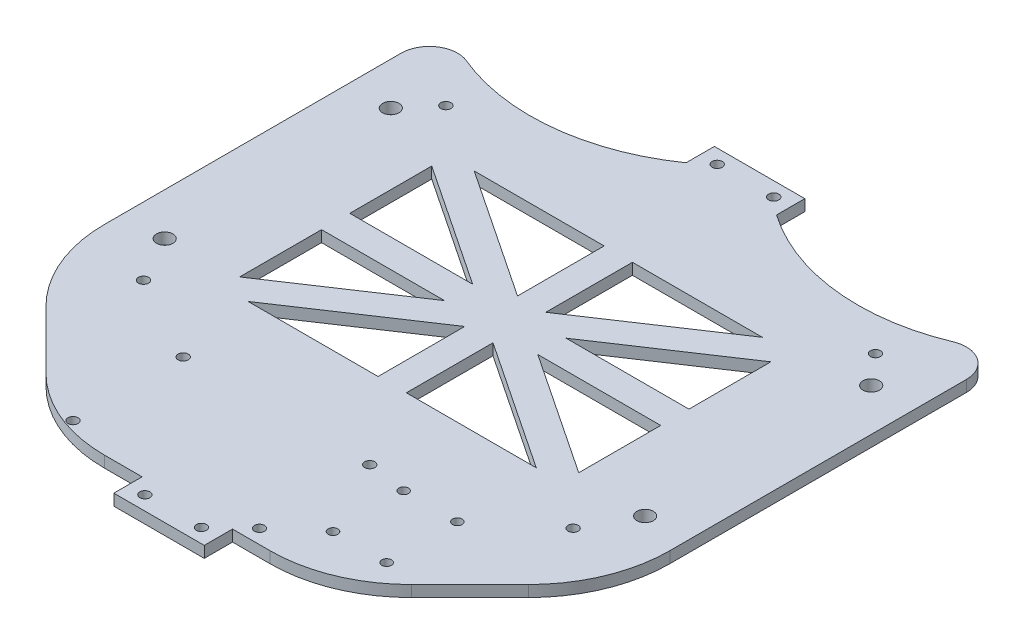
from build123d import *

# Parameters (mm, degrees)
BOSS_EXTRUDE1_DEPTH      = 4
M5_CLEARANCE_HOLE1_D     = 5.8
FILLET1_R                = 10
M3_CLEARANCE_HOLE1_D     = 3.6
M3_CLEARANCE_HOLE1_DEPTH = 10
M3_CLEARANCE_HOLE1_TIP   = 1.081549114
CHAMFER1_SIZE            = 50
FILLET3_R                = 50
M3_CLEARANCE_HOLE2_D     = 3.6
M3_CLEARANCE_HOLE3_D     = 3.4


with BuildPart() as part:
    # Sketch1 → Boss-Extrude1 (new body)
    with BuildSketch(Plane(origin=(0, 0, 0), x_dir=(1, 0, 0), z_dir=(0, 1, 0))):
        with BuildLine():
            Line((-100, -29.5), (-100, -222))
            Line((-100, -222), (-16, -222))
            Line((-16, -222), (-16, -232))
            Line((-16, -232), (16, -232))
            Line((16, -232), (16, -222))
            Line((16, -222), (100, -222))
            Line((100, -222), (100, -29.5))
            ThreePointArc((100, -29.5), (58, -42.739333694), (16, -29.5))
            Line((16, -29.5), (16, -19.5))
            Line((16, -19.5), (-16, -19.5))
            Line((-16, -19.5), (-16, -29.5))
            ThreePointArc((-16, -29.5), (-58, -42.739333694), (-100, -29.5))
        make_face()
        Polygon((-60, -143.490747874), (-60, -114.5), (-16.513878189, -114.5), align=None, mode=Mode.SUBTRACT)
        Polygon((-5, -149.5), (-50.986121811, -149.5), (-5, -118.842585459), align=None, mode=Mode.SUBTRACT)
        Polygon((50.986121811, -149.5), (5, -149.5), (5, -118.842585459), align=None, mode=Mode.SUBTRACT)
        Polygon((60, -114.5), (60, -143.490747874), (16.513878189, -114.5), align=None, mode=Mode.SUBTRACT)
        Polygon((60, -75.509252126), (60, -104.5), (16.513878189, -104.5), align=None, mode=Mode.SUBTRACT)
        Polygon((5, -69.5), (50.986121811, -69.5), (5, -100.157414541), align=None, mode=Mode.SUBTRACT)
        Polygon((-50.986121811, -69.5), (-5, -69.5), (-5, -100.157414541), align=None, mode=Mode.SUBTRACT)
        Polygon((-60, -104.5), (-60, -75.509252126), (-16.513878189, -104.5), align=None, mode=Mode.SUBTRACT)
    extrude(amount=BOSS_EXTRUDE1_DEPTH)

    # M5 Clearance Hole1 (through all)
    with Locations(Plane(origin=(0, 4, 0), x_dir=(1, 0, 0), z_dir=(0, 1, 0))):
        with Locations((-85, -65), (-85, -145), (85, -145), (85, -65)):
            Hole(M5_CLEARANCE_HOLE1_D / 2)

    # Fillet1
    fillet1_edges = [part.edges().sort_by_distance(p)[0] for p in [
        (100, 2, 29.5),
        (-100, 2, 29.5),
    ]]
    fillet(fillet1_edges, radius=FILLET1_R)

    # M3 Clearance Hole1
    with Locations(Plane(origin=(0, 4, 0), x_dir=(1, 0, 0), z_dir=(0, 1, 0))):
        with Locations((-45.45, -217), (-45.45, -178), (20.55, -178), (20.55, -217)):
            Hole(M3_CLEARANCE_HOLE1_D / 2, depth=M3_CLEARANCE_HOLE1_DEPTH)
            with Locations((0, 0, -(M3_CLEARANCE_HOLE1_DEPTH + M3_CLEARANCE_HOLE1_TIP / 2))):  # 118° drill point
                Cone(0, M3_CLEARANCE_HOLE1_D / 2, M3_CLEARANCE_HOLE1_TIP, mode=Mode.SUBTRACT)

    # Chamfer1
    chamfer1_edges = [part.edges().sort_by_distance(p)[0] for p in [
        (100, 2, 222),
        (-100, 2, 222),
    ]]
    chamfer(chamfer1_edges, length=CHAMFER1_SIZE)

    # Fillet3
    fillet3_edges = [part.edges().sort_by_distance(p)[0] for p in [
        (-100, 2, 172),
        (-50, 2, 222),
        (100, 2, 172),
        (50, 2, 222),
    ]]
    fillet(fillet3_edges, radius=FILLET3_R)

    # M3 Clearance Hole2 (through all)
    with Locations(Plane(origin=(0, 4, 0), x_dir=(1, 0, 0), z_dir=(0, 1, 0))):
        with Locations((-76, -54.5), (76, -54.5), (76, -161.5), (-76, -161.5), (-10, -24.5), (10, -24.5), (-10, -227), (10, -227)):
            Hole(M3_CLEARANCE_HOLE2_D / 2)

    # M3 Clearance Hole3 (through all)
    with Locations(Plane(origin=(0, 4, 0), x_dir=(1, 0, 0), z_dir=(0, 1, 0))):
        with Locations((53.55, -180), (34.55, -180), (34.55, -205), (53.55, -205)):
            Hole(M3_CLEARANCE_HOLE3_D / 2)


solid = part.part
